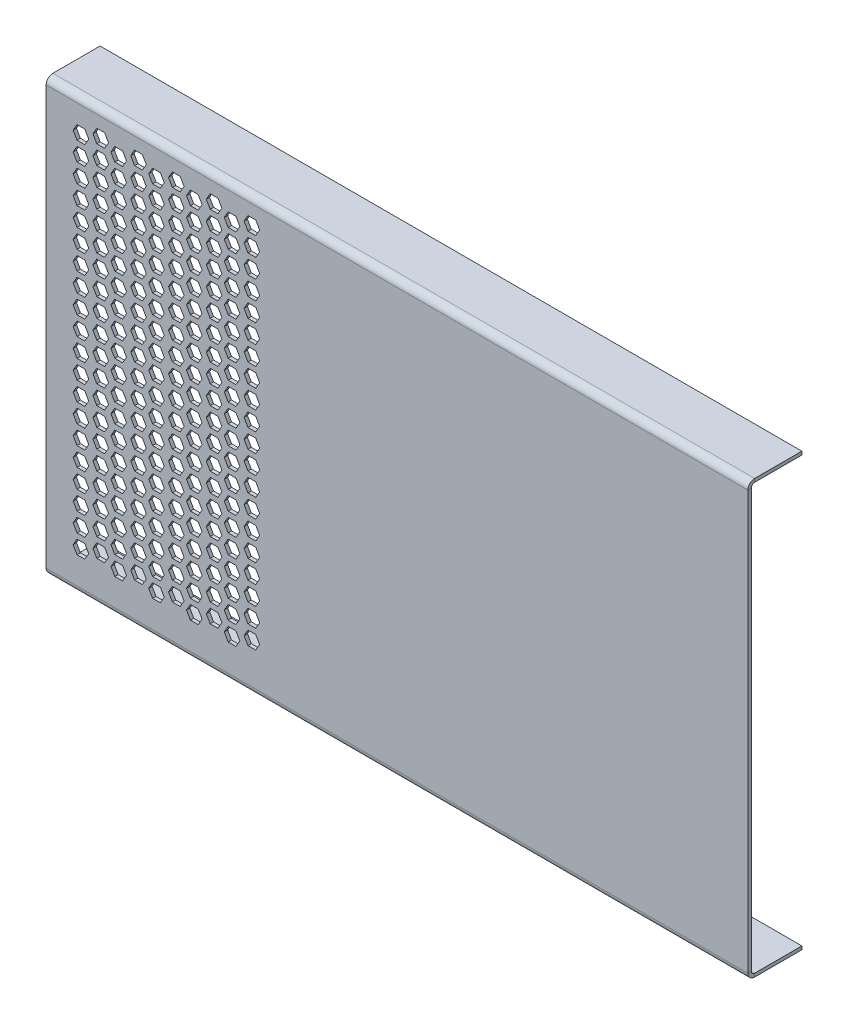
from build123d import *

# Parameters (mm, degrees)
SKETCH1_W                      = 330.2
SKETCH1_H                      = 203.2
BOSS_EXTRUDE1_DEPTH            = 1.5875
EDGE_FLANGE2_STRIP_W           = 9.525
EDGE_FLANGE2_STRIP_H           = 1.5875
EDGE_FLANGE2_STRIP_CUT_DEPTH   = 330.2
EDGE_FLANGE2_STRIP_2_W         = 9.525
EDGE_FLANGE2_STRIP_2_H         = 1.5875
EDGE_FLANGE2_STRIP_CUT_2_DEPTH = 330.2
EDGE_FLANGE2_DEPTH             = 330.2
EDGE_FLANGE2_BEND_DEPTH        = 330.2
CUT_EXTRUDE2_DEPTH             = 389.545286936


# Sheet-metal steps are written as plain solids
with BuildPart() as part:
    # Sketch1 → Boss-Extrude1 (new body)
    with BuildSketch(Plane.XY):
        with Locations((165.1, 101.6)):
            Rectangle(SKETCH1_W, SKETCH1_H)
    extrude(amount=BOSS_EXTRUDE1_DEPTH)

    # Edge-Flange2 strip (across the edge) → Edge-Flange2 strip cut (cut)
    with BuildSketch(Plane(origin=(330.2, 0, 0), x_dir=(0, 1, 0), z_dir=(-1, 0, 0))):
        with Locations((-1.5875, -0.79375)):
            Rectangle(EDGE_FLANGE2_STRIP_W, EDGE_FLANGE2_STRIP_H)
    extrude(amount=EDGE_FLANGE2_STRIP_CUT_DEPTH, mode=Mode.SUBTRACT)

    # Edge-Flange2 strip 2 (across the edge) → Edge-Flange2 strip cut 2 (cut)
    with BuildSketch(Plane(origin=(0, 203.2, 0), x_dir=(0, -1, 0), z_dir=(1, 0, 0))):
        with Locations((-1.5875, -0.79375)):
            Rectangle(EDGE_FLANGE2_STRIP_2_W, EDGE_FLANGE2_STRIP_2_H)
    extrude(amount=EDGE_FLANGE2_STRIP_CUT_2_DEPTH, mode=Mode.SUBTRACT)

    # Edge-Flange2 section (across the edge) → Edge-Flange2 (add)
    with BuildSketch(Plane(origin=(330.2, 0, 0), x_dir=(0, 1, 0), z_dir=(-1, 0, 0))):
        with BuildLine():
            Line((0, 1.5875), (0, 23.8125))
            Line((0, 23.8125), (1.5875, 23.8125))
            Line((1.5875, 23.8125), (1.5875, 1.5875))
            ThreePointArc((1.5875, 1.5875), (2.052467985, 0.464967985), (3.175, 0))
            Line((3.175, 0), (3.175, -1.5875))
            ThreePointArc((3.175, -1.5875), (0.92993597, -0.65756403), (0, 1.5875))
        make_face()
    extrude(amount=EDGE_FLANGE2_DEPTH)

    # Edge-Flange2 section 2 (across the edge) → Edge-Flange2 bend (add)
    with BuildSketch(Plane(origin=(0, 203.2, 0), x_dir=(0, -1, 0), z_dir=(1, 0, 0))):
        with BuildLine():
            Line((0, 1.5875), (0, 23.8125))
            Line((0, 23.8125), (1.5875, 23.8125))
            Line((1.5875, 23.8125), (1.5875, 1.5875))
            ThreePointArc((1.5875, 1.5875), (2.052467985, 0.464967985), (3.175, 0))
            Line((3.175, 0), (3.175, -1.5875))
            ThreePointArc((3.175, -1.5875), (0.92993597, -0.65756403), (0, 1.5875))
        make_face()
    extrude(amount=EDGE_FLANGE2_BEND_DEPTH)

    # Sketch38 → Cut-Extrude2 (cut, through all)
    with BuildSketch(Plane.XY.offset(1.5875)):
        Polygon((20.032348419, 19.05), (18.199261314, 22.225), (14.533087105, 22.225), (12.7, 19.05), (14.533087105, 15.875), (18.199261314, 15.875), align=None)
        Polygon((29.341609733, 22.225), (27.508522628, 25.4), (23.842348419, 25.4), (22.009261314, 22.225), (23.842348419, 19.05), (27.508522628, 19.05), align=None)
        Polygon((37.812348419, 19.05), (35.979261314, 22.225), (32.313087105, 22.225), (30.48, 19.05), (32.313087105, 15.875), (35.979261314, 15.875), align=None)
        Polygon((47.121609733, 22.225), (45.288522628, 25.4), (41.622348419, 25.4), (39.789261314, 22.225), (41.622348419, 19.05), (45.288522628, 19.05), align=None)
        Polygon((55.592348419, 19.05), (53.759261314, 22.225), (50.093087105, 22.225), (48.26, 19.05), (50.093087105, 15.875), (53.759261314, 15.875), align=None)
        Polygon((64.901609733, 22.225), (63.068522628, 25.4), (59.402348419, 25.4), (57.569261314, 22.225), (59.402348419, 19.05), (63.068522628, 19.05), align=None)
        Polygon((73.372348419, 19.05), (71.539261314, 22.225), (67.873087105, 22.225), (66.04, 19.05), (67.873087105, 15.875), (71.539261314, 15.875), align=None)
        Polygon((82.681609733, 22.225), (80.848522628, 25.4), (77.182348419, 25.4), (75.349261314, 22.225), (77.182348419, 19.05), (80.848522628, 19.05), align=None)
        Polygon((91.152348419, 19.05), (89.319261314, 22.225), (85.653087105, 22.225), (83.82, 19.05), (85.653087105, 15.875), (89.319261314, 15.875), align=None)
        Polygon((100.461609733, 22.225), (98.628522628, 25.4), (94.962348419, 25.4), (93.129261314, 22.225), (94.962348419, 19.05), (98.628522628, 19.05), align=None)
        Polygon((37.812348419, 27.94), (35.979261314, 31.115), (32.313087105, 31.115), (30.48, 27.94), (32.313087105, 24.765), (35.979261314, 24.765), align=None)
        Polygon((47.121609733, 31.115), (45.288522628, 34.29), (41.622348419, 34.29), (39.789261314, 31.115), (41.622348419, 27.94), (45.288522628, 27.94), align=None)
        Polygon((55.592348419, 27.94), (53.759261314, 31.115), (50.093087105, 31.115), (48.26, 27.94), (50.093087105, 24.765), (53.759261314, 24.765), align=None)
        Polygon((64.901609733, 31.115), (63.068522628, 34.29), (59.402348419, 34.29), (57.569261314, 31.115), (59.402348419, 27.94), (63.068522628, 27.94), align=None)
        Polygon((73.372348419, 27.94), (71.539261314, 31.115), (67.873087105, 31.115), (66.04, 27.94), (67.873087105, 24.765), (71.539261314, 24.765), align=None)
        Polygon((82.681609733, 31.115), (80.848522628, 34.29), (77.182348419, 34.29), (75.349261314, 31.115), (77.182348419, 27.94), (80.848522628, 27.94), align=None)
        Polygon((91.152348419, 27.94), (89.319261314, 31.115), (85.653087105, 31.115), (83.82, 27.94), (85.653087105, 24.765), (89.319261314, 24.765), align=None)
        Polygon((100.461609733, 31.115), (98.628522628, 34.29), (94.962348419, 34.29), (93.129261314, 31.115), (94.962348419, 27.94), (98.628522628, 27.94), align=None)
        Polygon((37.812348419, 36.83), (35.979261314, 40.005), (32.313087105, 40.005), (30.48, 36.83), (32.313087105, 33.655), (35.979261314, 33.655), align=None)
        Polygon((47.121609733, 40.005), (45.288522628, 43.18), (41.622348419, 43.18), (39.789261314, 40.005), (41.622348419, 36.83), (45.288522628, 36.83), align=None)
        Polygon((55.592348419, 36.83), (53.759261314, 40.005), (50.093087105, 40.005), (48.26, 36.83), (50.093087105, 33.655), (53.759261314, 33.655), align=None)
        Polygon((64.901609733, 40.005), (63.068522628, 43.18), (59.402348419, 43.18), (57.569261314, 40.005), (59.402348419, 36.83), (63.068522628, 36.83), align=None)
        Polygon((73.372348419, 36.83), (71.539261314, 40.005), (67.873087105, 40.005), (66.04, 36.83), (67.873087105, 33.655), (71.539261314, 33.655), align=None)
        Polygon((82.681609733, 40.005), (80.848522628, 43.18), (77.182348419, 43.18), (75.349261314, 40.005), (77.182348419, 36.83), (80.848522628, 36.83), align=None)
        Polygon((91.152348419, 36.83), (89.319261314, 40.005), (85.653087105, 40.005), (83.82, 36.83), (85.653087105, 33.655), (89.319261314, 33.655), align=None)
        Polygon((100.461609733, 40.005), (98.628522628, 43.18), (94.962348419, 43.18), (93.129261314, 40.005), (94.962348419, 36.83), (98.628522628, 36.83), align=None)
        Polygon((37.812348419, 45.72), (35.979261314, 48.895), (32.313087105, 48.895), (30.48, 45.72), (32.313087105, 42.545), (35.979261314, 42.545), align=None)
        Polygon((47.121609733, 48.895), (45.288522628, 52.07), (41.622348419, 52.07), (39.789261314, 48.895), (41.622348419, 45.72), (45.288522628, 45.72), align=None)
        Polygon((55.592348419, 45.72), (53.759261314, 48.895), (50.093087105, 48.895), (48.26, 45.72), (50.093087105, 42.545), (53.759261314, 42.545), align=None)
        Polygon((64.901609733, 48.895), (63.068522628, 52.07), (59.402348419, 52.07), (57.569261314, 48.895), (59.402348419, 45.72), (63.068522628, 45.72), align=None)
        Polygon((73.372348419, 45.72), (71.539261314, 48.895), (67.873087105, 48.895), (66.04, 45.72), (67.873087105, 42.545), (71.539261314, 42.545), align=None)
        Polygon((82.681609733, 48.895), (80.848522628, 52.07), (77.182348419, 52.07), (75.349261314, 48.895), (77.182348419, 45.72), (80.848522628, 45.72), align=None)
        Polygon((91.152348419, 45.72), (89.319261314, 48.895), (85.653087105, 48.895), (83.82, 45.72), (85.653087105, 42.545), (89.319261314, 42.545), align=None)
        Polygon((100.461609733, 48.895), (98.628522628, 52.07), (94.962348419, 52.07), (93.129261314, 48.895), (94.962348419, 45.72), (98.628522628, 45.72), align=None)
        Polygon((37.812348419, 54.61), (35.979261314, 57.785), (32.313087105, 57.785), (30.48, 54.61), (32.313087105, 51.435), (35.979261314, 51.435), align=None)
        Polygon((47.121609733, 57.785), (45.288522628, 60.96), (41.622348419, 60.96), (39.789261314, 57.785), (41.622348419, 54.61), (45.288522628, 54.61), align=None)
        Polygon((55.592348419, 54.61), (53.759261314, 57.785), (50.093087105, 57.785), (48.26, 54.61), (50.093087105, 51.435), (53.759261314, 51.435), align=None)
        Polygon((64.901609733, 57.785), (63.068522628, 60.96), (59.402348419, 60.96), (57.569261314, 57.785), (59.402348419, 54.61), (63.068522628, 54.61), align=None)
        Polygon((73.372348419, 54.61), (71.539261314, 57.785), (67.873087105, 57.785), (66.04, 54.61), (67.873087105, 51.435), (71.539261314, 51.435), align=None)
        Polygon((82.681609733, 57.785), (80.848522628, 60.96), (77.182348419, 60.96), (75.349261314, 57.785), (77.182348419, 54.61), (80.848522628, 54.61), align=None)
        Polygon((91.152348419, 54.61), (89.319261314, 57.785), (85.653087105, 57.785), (83.82, 54.61), (85.653087105, 51.435), (89.319261314, 51.435), align=None)
        Polygon((100.461609733, 57.785), (98.628522628, 60.96), (94.962348419, 60.96), (93.129261314, 57.785), (94.962348419, 54.61), (98.628522628, 54.61), align=None)
        Polygon((37.812348419, 63.5), (35.979261314, 66.675), (32.313087105, 66.675), (30.48, 63.5), (32.313087105, 60.325), (35.979261314, 60.325), align=None)
        Polygon((47.121609733, 66.675), (45.288522628, 69.85), (41.622348419, 69.85), (39.789261314, 66.675), (41.622348419, 63.5), (45.288522628, 63.5), align=None)
        Polygon((55.592348419, 63.5), (53.759261314, 66.675), (50.093087105, 66.675), (48.26, 63.5), (50.093087105, 60.325), (53.759261314, 60.325), align=None)
        Polygon((64.901609733, 66.675), (63.068522628, 69.85), (59.402348419, 69.85), (57.569261314, 66.675), (59.402348419, 63.5), (63.068522628, 63.5), align=None)
        Polygon((73.372348419, 63.5), (71.539261314, 66.675), (67.873087105, 66.675), (66.04, 63.5), (67.873087105, 60.325), (71.539261314, 60.325), align=None)
        Polygon((82.681609733, 66.675), (80.848522628, 69.85), (77.182348419, 69.85), (75.349261314, 66.675), (77.182348419, 63.5), (80.848522628, 63.5), align=None)
        Polygon((91.152348419, 63.5), (89.319261314, 66.675), (85.653087105, 66.675), (83.82, 63.5), (85.653087105, 60.325), (89.319261314, 60.325), align=None)
        Polygon((100.461609733, 66.675), (98.628522628, 69.85), (94.962348419, 69.85), (93.129261314, 66.675), (94.962348419, 63.5), (98.628522628, 63.5), align=None)
        Polygon((37.812348419, 72.39), (35.979261314, 75.565), (32.313087105, 75.565), (30.48, 72.39), (32.313087105, 69.215), (35.979261314, 69.215), align=None)
        Polygon((47.121609733, 75.565), (45.288522628, 78.74), (41.622348419, 78.74), (39.789261314, 75.565), (41.622348419, 72.39), (45.288522628, 72.39), align=None)
        Polygon((55.592348419, 72.39), (53.759261314, 75.565), (50.093087105, 75.565), (48.26, 72.39), (50.093087105, 69.215), (53.759261314, 69.215), align=None)
        Polygon((64.901609733, 75.565), (63.068522628, 78.74), (59.402348419, 78.74), (57.569261314, 75.565), (59.402348419, 72.39), (63.068522628, 72.39), align=None)
        Polygon((73.372348419, 72.39), (71.539261314, 75.565), (67.873087105, 75.565), (66.04, 72.39), (67.873087105, 69.215), (71.539261314, 69.215), align=None)
        Polygon((82.681609733, 75.565), (80.848522628, 78.74), (77.182348419, 78.74), (75.349261314, 75.565), (77.182348419, 72.39), (80.848522628, 72.39), align=None)
        Polygon((91.152348419, 72.39), (89.319261314, 75.565), (85.653087105, 75.565), (83.82, 72.39), (85.653087105, 69.215), (89.319261314, 69.215), align=None)
        Polygon((100.461609733, 75.565), (98.628522628, 78.74), (94.962348419, 78.74), (93.129261314, 75.565), (94.962348419, 72.39), (98.628522628, 72.39), align=None)
        Polygon((37.812348419, 81.28), (35.979261314, 84.455), (32.313087105, 84.455), (30.48, 81.28), (32.313087105, 78.105), (35.979261314, 78.105), align=None)
        Polygon((47.121609733, 84.455), (45.288522628, 87.63), (41.622348419, 87.63), (39.789261314, 84.455), (41.622348419, 81.28), (45.288522628, 81.28), align=None)
        Polygon((55.592348419, 81.28), (53.759261314, 84.455), (50.093087105, 84.455), (48.26, 81.28), (50.093087105, 78.105), (53.759261314, 78.105), align=None)
        Polygon((64.901609733, 84.455), (63.068522628, 87.63), (59.402348419, 87.63), (57.569261314, 84.455), (59.402348419, 81.28), (63.068522628, 81.28), align=None)
        Polygon((73.372348419, 81.28), (71.539261314, 84.455), (67.873087105, 84.455), (66.04, 81.28), (67.873087105, 78.105), (71.539261314, 78.105), align=None)
        Polygon((82.681609733, 84.455), (80.848522628, 87.63), (77.182348419, 87.63), (75.349261314, 84.455), (77.182348419, 81.28), (80.848522628, 81.28), align=None)
        Polygon((91.152348419, 81.28), (89.319261314, 84.455), (85.653087105, 84.455), (83.82, 81.28), (85.653087105, 78.105), (89.319261314, 78.105), align=None)
        Polygon((100.461609733, 84.455), (98.628522628, 87.63), (94.962348419, 87.63), (93.129261314, 84.455), (94.962348419, 81.28), (98.628522628, 81.28), align=None)
        Polygon((37.812348419, 90.17), (35.979261314, 93.345), (32.313087105, 93.345), (30.48, 90.17), (32.313087105, 86.995), (35.979261314, 86.995), align=None)
        Polygon((47.121609733, 93.345), (45.288522628, 96.52), (41.622348419, 96.52), (39.789261314, 93.345), (41.622348419, 90.17), (45.288522628, 90.17), align=None)
        Polygon((55.592348419, 90.17), (53.759261314, 93.345), (50.093087105, 93.345), (48.26, 90.17), (50.093087105, 86.995), (53.759261314, 86.995), align=None)
        Polygon((64.901609733, 93.345), (63.068522628, 96.52), (59.402348419, 96.52), (57.569261314, 93.345), (59.402348419, 90.17), (63.068522628, 90.17), align=None)
        Polygon((73.372348419, 90.17), (71.539261314, 93.345), (67.873087105, 93.345), (66.04, 90.17), (67.873087105, 86.995), (71.539261314, 86.995), align=None)
        Polygon((82.681609733, 93.345), (80.848522628, 96.52), (77.182348419, 96.52), (75.349261314, 93.345), (77.182348419, 90.17), (80.848522628, 90.17), align=None)
        Polygon((91.152348419, 90.17), (89.319261314, 93.345), (85.653087105, 93.345), (83.82, 90.17), (85.653087105, 86.995), (89.319261314, 86.995), align=None)
        Polygon((100.461609733, 93.345), (98.628522628, 96.52), (94.962348419, 96.52), (93.129261314, 93.345), (94.962348419, 90.17), (98.628522628, 90.17), align=None)
        Polygon((37.812348419, 99.06), (35.979261314, 102.235), (32.313087105, 102.235), (30.48, 99.06), (32.313087105, 95.885), (35.979261314, 95.885), align=None)
        Polygon((47.121609733, 102.235), (45.288522628, 105.41), (41.622348419, 105.41), (39.789261314, 102.235), (41.622348419, 99.06), (45.288522628, 99.06), align=None)
        Polygon((55.592348419, 99.06), (53.759261314, 102.235), (50.093087105, 102.235), (48.26, 99.06), (50.093087105, 95.885), (53.759261314, 95.885), align=None)
        Polygon((64.901609733, 102.235), (63.068522628, 105.41), (59.402348419, 105.41), (57.569261314, 102.235), (59.402348419, 99.06), (63.068522628, 99.06), align=None)
        Polygon((73.372348419, 99.06), (71.539261314, 102.235), (67.873087105, 102.235), (66.04, 99.06), (67.873087105, 95.885), (71.539261314, 95.885), align=None)
        Polygon((82.681609733, 102.235), (80.848522628, 105.41), (77.182348419, 105.41), (75.349261314, 102.235), (77.182348419, 99.06), (80.848522628, 99.06), align=None)
        Polygon((91.152348419, 99.06), (89.319261314, 102.235), (85.653087105, 102.235), (83.82, 99.06), (85.653087105, 95.885), (89.319261314, 95.885), align=None)
        Polygon((100.461609733, 102.235), (98.628522628, 105.41), (94.962348419, 105.41), (93.129261314, 102.235), (94.962348419, 99.06), (98.628522628, 99.06), align=None)
        Polygon((37.812348419, 107.95), (35.979261314, 111.125), (32.313087105, 111.125), (30.48, 107.95), (32.313087105, 104.775), (35.979261314, 104.775), align=None)
        Polygon((47.121609733, 111.125), (45.288522628, 114.3), (41.622348419, 114.3), (39.789261314, 111.125), (41.622348419, 107.95), (45.288522628, 107.95), align=None)
        Polygon((55.592348419, 107.95), (53.759261314, 111.125), (50.093087105, 111.125), (48.26, 107.95), (50.093087105, 104.775), (53.759261314, 104.775), align=None)
        Polygon((64.901609733, 111.125), (63.068522628, 114.3), (59.402348419, 114.3), (57.569261314, 111.125), (59.402348419, 107.95), (63.068522628, 107.95), align=None)
        Polygon((73.372348419, 107.95), (71.539261314, 111.125), (67.873087105, 111.125), (66.04, 107.95), (67.873087105, 104.775), (71.539261314, 104.775), align=None)
        Polygon((82.681609733, 111.125), (80.848522628, 114.3), (77.182348419, 114.3), (75.349261314, 111.125), (77.182348419, 107.95), (80.848522628, 107.95), align=None)
        Polygon((91.152348419, 107.95), (89.319261314, 111.125), (85.653087105, 111.125), (83.82, 107.95), (85.653087105, 104.775), (89.319261314, 104.775), align=None)
        Polygon((100.461609733, 111.125), (98.628522628, 114.3), (94.962348419, 114.3), (93.129261314, 111.125), (94.962348419, 107.95), (98.628522628, 107.95), align=None)
        Polygon((37.812348419, 116.84), (35.979261314, 120.015), (32.313087105, 120.015), (30.48, 116.84), (32.313087105, 113.665), (35.979261314, 113.665), align=None)
        Polygon((47.121609733, 120.015), (45.288522628, 123.19), (41.622348419, 123.19), (39.789261314, 120.015), (41.622348419, 116.84), (45.288522628, 116.84), align=None)
        Polygon((55.592348419, 116.84), (53.759261314, 120.015), (50.093087105, 120.015), (48.26, 116.84), (50.093087105, 113.665), (53.759261314, 113.665), align=None)
        Polygon((64.901609733, 120.015), (63.068522628, 123.19), (59.402348419, 123.19), (57.569261314, 120.015), (59.402348419, 116.84), (63.068522628, 116.84), align=None)
        Polygon((73.372348419, 116.84), (71.539261314, 120.015), (67.873087105, 120.015), (66.04, 116.84), (67.873087105, 113.665), (71.539261314, 113.665), align=None)
        Polygon((82.681609733, 120.015), (80.848522628, 123.19), (77.182348419, 123.19), (75.349261314, 120.015), (77.182348419, 116.84), (80.848522628, 116.84), align=None)
        Polygon((91.152348419, 116.84), (89.319261314, 120.015), (85.653087105, 120.015), (83.82, 116.84), (85.653087105, 113.665), (89.319261314, 113.665), align=None)
        Polygon((100.461609733, 120.015), (98.628522628, 123.19), (94.962348419, 123.19), (93.129261314, 120.015), (94.962348419, 116.84), (98.628522628, 116.84), align=None)
        Polygon((37.812348419, 125.73), (35.979261314, 128.905), (32.313087105, 128.905), (30.48, 125.73), (32.313087105, 122.555), (35.979261314, 122.555), align=None)
        Polygon((47.121609733, 128.905), (45.288522628, 132.08), (41.622348419, 132.08), (39.789261314, 128.905), (41.622348419, 125.73), (45.288522628, 125.73), align=None)
        Polygon((55.592348419, 125.73), (53.759261314, 128.905), (50.093087105, 128.905), (48.26, 125.73), (50.093087105, 122.555), (53.759261314, 122.555), align=None)
        Polygon((64.901609733, 128.905), (63.068522628, 132.08), (59.402348419, 132.08), (57.569261314, 128.905), (59.402348419, 125.73), (63.068522628, 125.73), align=None)
        Polygon((73.372348419, 125.73), (71.539261314, 128.905), (67.873087105, 128.905), (66.04, 125.73), (67.873087105, 122.555), (71.539261314, 122.555), align=None)
        Polygon((82.681609733, 128.905), (80.848522628, 132.08), (77.182348419, 132.08), (75.349261314, 128.905), (77.182348419, 125.73), (80.848522628, 125.73), align=None)
        Polygon((91.152348419, 125.73), (89.319261314, 128.905), (85.653087105, 128.905), (83.82, 125.73), (85.653087105, 122.555), (89.319261314, 122.555), align=None)
        Polygon((100.461609733, 128.905), (98.628522628, 132.08), (94.962348419, 132.08), (93.129261314, 128.905), (94.962348419, 125.73), (98.628522628, 125.73), align=None)
        Polygon((37.812348419, 134.62), (35.979261314, 137.795), (32.313087105, 137.795), (30.48, 134.62), (32.313087105, 131.445), (35.979261314, 131.445), align=None)
        Polygon((47.121609733, 137.795), (45.288522628, 140.97), (41.622348419, 140.97), (39.789261314, 137.795), (41.622348419, 134.62), (45.288522628, 134.62), align=None)
        Polygon((55.592348419, 134.62), (53.759261314, 137.795), (50.093087105, 137.795), (48.26, 134.62), (50.093087105, 131.445), (53.759261314, 131.445), align=None)
        Polygon((64.901609733, 137.795), (63.068522628, 140.97), (59.402348419, 140.97), (57.569261314, 137.795), (59.402348419, 134.62), (63.068522628, 134.62), align=None)
        Polygon((73.372348419, 134.62), (71.539261314, 137.795), (67.873087105, 137.795), (66.04, 134.62), (67.873087105, 131.445), (71.539261314, 131.445), align=None)
        Polygon((82.681609733, 137.795), (80.848522628, 140.97), (77.182348419, 140.97), (75.349261314, 137.795), (77.182348419, 134.62), (80.848522628, 134.62), align=None)
        Polygon((91.152348419, 134.62), (89.319261314, 137.795), (85.653087105, 137.795), (83.82, 134.62), (85.653087105, 131.445), (89.319261314, 131.445), align=None)
        Polygon((100.461609733, 137.795), (98.628522628, 140.97), (94.962348419, 140.97), (93.129261314, 137.795), (94.962348419, 134.62), (98.628522628, 134.62), align=None)
        Polygon((37.812348419, 143.51), (35.979261314, 146.685), (32.313087105, 146.685), (30.48, 143.51), (32.313087105, 140.335), (35.979261314, 140.335), align=None)
        Polygon((47.121609733, 146.685), (45.288522628, 149.86), (41.622348419, 149.86), (39.789261314, 146.685), (41.622348419, 143.51), (45.288522628, 143.51), align=None)
        Polygon((55.592348419, 143.51), (53.759261314, 146.685), (50.093087105, 146.685), (48.26, 143.51), (50.093087105, 140.335), (53.759261314, 140.335), align=None)
        Polygon((64.901609733, 146.685), (63.068522628, 149.86), (59.402348419, 149.86), (57.569261314, 146.685), (59.402348419, 143.51), (63.068522628, 143.51), align=None)
        Polygon((73.372348419, 143.51), (71.539261314, 146.685), (67.873087105, 146.685), (66.04, 143.51), (67.873087105, 140.335), (71.539261314, 140.335), align=None)
        Polygon((82.681609733, 146.685), (80.848522628, 149.86), (77.182348419, 149.86), (75.349261314, 146.685), (77.182348419, 143.51), (80.848522628, 143.51), align=None)
        Polygon((91.152348419, 143.51), (89.319261314, 146.685), (85.653087105, 146.685), (83.82, 143.51), (85.653087105, 140.335), (89.319261314, 140.335), align=None)
        Polygon((100.461609733, 146.685), (98.628522628, 149.86), (94.962348419, 149.86), (93.129261314, 146.685), (94.962348419, 143.51), (98.628522628, 143.51), align=None)
        Polygon((37.812348419, 152.4), (35.979261314, 155.575), (32.313087105, 155.575), (30.48, 152.4), (32.313087105, 149.225), (35.979261314, 149.225), align=None)
        Polygon((47.121609733, 155.575), (45.288522628, 158.75), (41.622348419, 158.75), (39.789261314, 155.575), (41.622348419, 152.4), (45.288522628, 152.4), align=None)
        Polygon((55.592348419, 152.4), (53.759261314, 155.575), (50.093087105, 155.575), (48.26, 152.4), (50.093087105, 149.225), (53.759261314, 149.225), align=None)
        Polygon((64.901609733, 155.575), (63.068522628, 158.75), (59.402348419, 158.75), (57.569261314, 155.575), (59.402348419, 152.4), (63.068522628, 152.4), align=None)
        Polygon((73.372348419, 152.4), (71.539261314, 155.575), (67.873087105, 155.575), (66.04, 152.4), (67.873087105, 149.225), (71.539261314, 149.225), align=None)
        Polygon((82.681609733, 155.575), (80.848522628, 158.75), (77.182348419, 158.75), (75.349261314, 155.575), (77.182348419, 152.4), (80.848522628, 152.4), align=None)
        Polygon((91.152348419, 152.4), (89.319261314, 155.575), (85.653087105, 155.575), (83.82, 152.4), (85.653087105, 149.225), (89.319261314, 149.225), align=None)
        Polygon((100.461609733, 155.575), (98.628522628, 158.75), (94.962348419, 158.75), (93.129261314, 155.575), (94.962348419, 152.4), (98.628522628, 152.4), align=None)
        Polygon((37.812348419, 161.29), (35.979261314, 164.465), (32.313087105, 164.465), (30.48, 161.29), (32.313087105, 158.115), (35.979261314, 158.115), align=None)
        Polygon((47.121609733, 164.465), (45.288522628, 167.64), (41.622348419, 167.64), (39.789261314, 164.465), (41.622348419, 161.29), (45.288522628, 161.29), align=None)
        Polygon((55.592348419, 161.29), (53.759261314, 164.465), (50.093087105, 164.465), (48.26, 161.29), (50.093087105, 158.115), (53.759261314, 158.115), align=None)
        Polygon((64.901609733, 164.465), (63.068522628, 167.64), (59.402348419, 167.64), (57.569261314, 164.465), (59.402348419, 161.29), (63.068522628, 161.29), align=None)
        Polygon((73.372348419, 161.29), (71.539261314, 164.465), (67.873087105, 164.465), (66.04, 161.29), (67.873087105, 158.115), (71.539261314, 158.115), align=None)
        Polygon((82.681609733, 164.465), (80.848522628, 167.64), (77.182348419, 167.64), (75.349261314, 164.465), (77.182348419, 161.29), (80.848522628, 161.29), align=None)
        Polygon((91.152348419, 161.29), (89.319261314, 164.465), (85.653087105, 164.465), (83.82, 161.29), (85.653087105, 158.115), (89.319261314, 158.115), align=None)
        Polygon((100.461609733, 164.465), (98.628522628, 167.64), (94.962348419, 167.64), (93.129261314, 164.465), (94.962348419, 161.29), (98.628522628, 161.29), align=None)
        Polygon((37.812348419, 170.18), (35.979261314, 173.355), (32.313087105, 173.355), (30.48, 170.18), (32.313087105, 167.005), (35.979261314, 167.005), align=None)
        Polygon((47.121609733, 173.355), (45.288522628, 176.53), (41.622348419, 176.53), (39.789261314, 173.355), (41.622348419, 170.18), (45.288522628, 170.18), align=None)
        Polygon((55.592348419, 170.18), (53.759261314, 173.355), (50.093087105, 173.355), (48.26, 170.18), (50.093087105, 167.005), (53.759261314, 167.005), align=None)
        Polygon((64.901609733, 173.355), (63.068522628, 176.53), (59.402348419, 176.53), (57.569261314, 173.355), (59.402348419, 170.18), (63.068522628, 170.18), align=None)
        Polygon((73.372348419, 170.18), (71.539261314, 173.355), (67.873087105, 173.355), (66.04, 170.18), (67.873087105, 167.005), (71.539261314, 167.005), align=None)
        Polygon((82.681609733, 173.355), (80.848522628, 176.53), (77.182348419, 176.53), (75.349261314, 173.355), (77.182348419, 170.18), (80.848522628, 170.18), align=None)
        Polygon((91.152348419, 170.18), (89.319261314, 173.355), (85.653087105, 173.355), (83.82, 170.18), (85.653087105, 167.005), (89.319261314, 167.005), align=None)
        Polygon((100.461609733, 173.355), (98.628522628, 176.53), (94.962348419, 176.53), (93.129261314, 173.355), (94.962348419, 170.18), (98.628522628, 170.18), align=None)
        Polygon((37.812348419, 179.07), (35.979261314, 182.245), (32.313087105, 182.245), (30.48, 179.07), (32.313087105, 175.895), (35.979261314, 175.895), align=None)
        Polygon((47.121609733, 182.245), (45.288522628, 185.42), (41.622348419, 185.42), (39.789261314, 182.245), (41.622348419, 179.07), (45.288522628, 179.07), align=None)
        Polygon((55.592348419, 179.07), (53.759261314, 182.245), (50.093087105, 182.245), (48.26, 179.07), (50.093087105, 175.895), (53.759261314, 175.895), align=None)
        Polygon((64.901609733, 182.245), (63.068522628, 185.42), (59.402348419, 185.42), (57.569261314, 182.245), (59.402348419, 179.07), (63.068522628, 179.07), align=None)
        Polygon((73.372348419, 179.07), (71.539261314, 182.245), (67.873087105, 182.245), (66.04, 179.07), (67.873087105, 175.895), (71.539261314, 175.895), align=None)
        Polygon((82.681609733, 182.245), (80.848522628, 185.42), (77.182348419, 185.42), (75.349261314, 182.245), (77.182348419, 179.07), (80.848522628, 179.07), align=None)
        Polygon((91.152348419, 179.07), (89.319261314, 182.245), (85.653087105, 182.245), (83.82, 179.07), (85.653087105, 175.895), (89.319261314, 175.895), align=None)
        Polygon((100.461609733, 182.245), (98.628522628, 185.42), (94.962348419, 185.42), (93.129261314, 182.245), (94.962348419, 179.07), (98.628522628, 179.07), align=None)
        Polygon((37.812348419, 187.96), (35.979261314, 191.135), (32.313087105, 191.135), (30.48, 187.96), (32.313087105, 184.785), (35.979261314, 184.785), align=None)
        Polygon((47.121609733, 191.135), (45.288522628, 194.31), (41.622348419, 194.31), (39.789261314, 191.135), (41.622348419, 187.96), (45.288522628, 187.96), align=None)
        Polygon((55.592348419, 187.96), (53.759261314, 191.135), (50.093087105, 191.135), (48.26, 187.96), (50.093087105, 184.785), (53.759261314, 184.785), align=None)
        Polygon((64.901609733, 191.135), (63.068522628, 194.31), (59.402348419, 194.31), (57.569261314, 191.135), (59.402348419, 187.96), (63.068522628, 187.96), align=None)
        Polygon((73.372348419, 187.96), (71.539261314, 191.135), (67.873087105, 191.135), (66.04, 187.96), (67.873087105, 184.785), (71.539261314, 184.785), align=None)
        Polygon((82.681609733, 191.135), (80.848522628, 194.31), (77.182348419, 194.31), (75.349261314, 191.135), (77.182348419, 187.96), (80.848522628, 187.96), align=None)
        Polygon((91.152348419, 187.96), (89.319261314, 191.135), (85.653087105, 191.135), (83.82, 187.96), (85.653087105, 184.785), (89.319261314, 184.785), align=None)
        Polygon((100.461609733, 191.135), (98.628522628, 194.31), (94.962348419, 194.31), (93.129261314, 191.135), (94.962348419, 187.96), (98.628522628, 187.96), align=None)
        Polygon((20.032348419, 27.94), (18.199261314, 31.115), (14.533087105, 31.115), (12.7, 27.94), (14.533087105, 24.765), (18.199261314, 24.765), align=None)
        Polygon((29.341609733, 31.115), (27.508522628, 34.29), (23.842348419, 34.29), (22.009261314, 31.115), (23.842348419, 27.94), (27.508522628, 27.94), align=None)
        Polygon((20.032348419, 36.83), (18.199261314, 40.005), (14.533087105, 40.005), (12.7, 36.83), (14.533087105, 33.655), (18.199261314, 33.655), align=None)
        Polygon((29.341609733, 40.005), (27.508522628, 43.18), (23.842348419, 43.18), (22.009261314, 40.005), (23.842348419, 36.83), (27.508522628, 36.83), align=None)
        Polygon((20.032348419, 45.72), (18.199261314, 48.895), (14.533087105, 48.895), (12.7, 45.72), (14.533087105, 42.545), (18.199261314, 42.545), align=None)
        Polygon((29.341609733, 48.895), (27.508522628, 52.07), (23.842348419, 52.07), (22.009261314, 48.895), (23.842348419, 45.72), (27.508522628, 45.72), align=None)
        Polygon((20.032348419, 54.61), (18.199261314, 57.785), (14.533087105, 57.785), (12.7, 54.61), (14.533087105, 51.435), (18.199261314, 51.435), align=None)
        Polygon((29.341609733, 57.785), (27.508522628, 60.96), (23.842348419, 60.96), (22.009261314, 57.785), (23.842348419, 54.61), (27.508522628, 54.61), align=None)
        Polygon((20.032348419, 63.5), (18.199261314, 66.675), (14.533087105, 66.675), (12.7, 63.5), (14.533087105, 60.325), (18.199261314, 60.325), align=None)
        Polygon((29.341609733, 66.675), (27.508522628, 69.85), (23.842348419, 69.85), (22.009261314, 66.675), (23.842348419, 63.5), (27.508522628, 63.5), align=None)
        Polygon((20.032348419, 72.39), (18.199261314, 75.565), (14.533087105, 75.565), (12.7, 72.39), (14.533087105, 69.215), (18.199261314, 69.215), align=None)
        Polygon((29.341609733, 75.565), (27.508522628, 78.74), (23.842348419, 78.74), (22.009261314, 75.565), (23.842348419, 72.39), (27.508522628, 72.39), align=None)
        Polygon((20.032348419, 81.28), (18.199261314, 84.455), (14.533087105, 84.455), (12.7, 81.28), (14.533087105, 78.105), (18.199261314, 78.105), align=None)
        Polygon((29.341609733, 84.455), (27.508522628, 87.63), (23.842348419, 87.63), (22.009261314, 84.455), (23.842348419, 81.28), (27.508522628, 81.28), align=None)
        Polygon((20.032348419, 90.17), (18.199261314, 93.345), (14.533087105, 93.345), (12.7, 90.17), (14.533087105, 86.995), (18.199261314, 86.995), align=None)
        Polygon((29.341609733, 93.345), (27.508522628, 96.52), (23.842348419, 96.52), (22.009261314, 93.345), (23.842348419, 90.17), (27.508522628, 90.17), align=None)
        Polygon((20.032348419, 99.06), (18.199261314, 102.235), (14.533087105, 102.235), (12.7, 99.06), (14.533087105, 95.885), (18.199261314, 95.885), align=None)
        Polygon((29.341609733, 102.235), (27.508522628, 105.41), (23.842348419, 105.41), (22.009261314, 102.235), (23.842348419, 99.06), (27.508522628, 99.06), align=None)
        Polygon((20.032348419, 107.95), (18.199261314, 111.125), (14.533087105, 111.125), (12.7, 107.95), (14.533087105, 104.775), (18.199261314, 104.775), align=None)
        Polygon((29.341609733, 111.125), (27.508522628, 114.3), (23.842348419, 114.3), (22.009261314, 111.125), (23.842348419, 107.95), (27.508522628, 107.95), align=None)
        Polygon((20.032348419, 116.84), (18.199261314, 120.015), (14.533087105, 120.015), (12.7, 116.84), (14.533087105, 113.665), (18.199261314, 113.665), align=None)
        Polygon((29.341609733, 120.015), (27.508522628, 123.19), (23.842348419, 123.19), (22.009261314, 120.015), (23.842348419, 116.84), (27.508522628, 116.84), align=None)
        Polygon((20.032348419, 125.73), (18.199261314, 128.905), (14.533087105, 128.905), (12.7, 125.73), (14.533087105, 122.555), (18.199261314, 122.555), align=None)
        Polygon((29.341609733, 128.905), (27.508522628, 132.08), (23.842348419, 132.08), (22.009261314, 128.905), (23.842348419, 125.73), (27.508522628, 125.73), align=None)
        Polygon((20.032348419, 134.62), (18.199261314, 137.795), (14.533087105, 137.795), (12.7, 134.62), (14.533087105, 131.445), (18.199261314, 131.445), align=None)
        Polygon((29.341609733, 137.795), (27.508522628, 140.97), (23.842348419, 140.97), (22.009261314, 137.795), (23.842348419, 134.62), (27.508522628, 134.62), align=None)
        Polygon((20.032348419, 143.51), (18.199261314, 146.685), (14.533087105, 146.685), (12.7, 143.51), (14.533087105, 140.335), (18.199261314, 140.335), align=None)
        Polygon((29.341609733, 146.685), (27.508522628, 149.86), (23.842348419, 149.86), (22.009261314, 146.685), (23.842348419, 143.51), (27.508522628, 143.51), align=None)
        Polygon((20.032348419, 152.4), (18.199261314, 155.575), (14.533087105, 155.575), (12.7, 152.4), (14.533087105, 149.225), (18.199261314, 149.225), align=None)
        Polygon((29.341609733, 155.575), (27.508522628, 158.75), (23.842348419, 158.75), (22.009261314, 155.575), (23.842348419, 152.4), (27.508522628, 152.4), align=None)
        Polygon((20.032348419, 161.29), (18.199261314, 164.465), (14.533087105, 164.465), (12.7, 161.29), (14.533087105, 158.115), (18.199261314, 158.115), align=None)
        Polygon((29.341609733, 164.465), (27.508522628, 167.64), (23.842348419, 167.64), (22.009261314, 164.465), (23.842348419, 161.29), (27.508522628, 161.29), align=None)
        Polygon((20.032348419, 170.18), (18.199261314, 173.355), (14.533087105, 173.355), (12.7, 170.18), (14.533087105, 167.005), (18.199261314, 167.005), align=None)
        Polygon((29.341609733, 173.355), (27.508522628, 176.53), (23.842348419, 176.53), (22.009261314, 173.355), (23.842348419, 170.18), (27.508522628, 170.18), align=None)
        Polygon((20.032348419, 179.07), (18.199261314, 182.245), (14.533087105, 182.245), (12.7, 179.07), (14.533087105, 175.895), (18.199261314, 175.895), align=None)
        Polygon((29.341609733, 182.245), (27.508522628, 185.42), (23.842348419, 185.42), (22.009261314, 182.245), (23.842348419, 179.07), (27.508522628, 179.07), align=None)
        Polygon((20.032348419, 187.96), (18.199261314, 191.135), (14.533087105, 191.135), (12.7, 187.96), (14.533087105, 184.785), (18.199261314, 184.785), align=None)
        Polygon((29.341609733, 191.135), (27.508522628, 194.31), (23.842348419, 194.31), (22.009261314, 191.135), (23.842348419, 187.96), (27.508522628, 187.96), align=None)
    extrude(amount=-CUT_EXTRUDE2_DEPTH, mode=Mode.SUBTRACT)


solid = part.part
